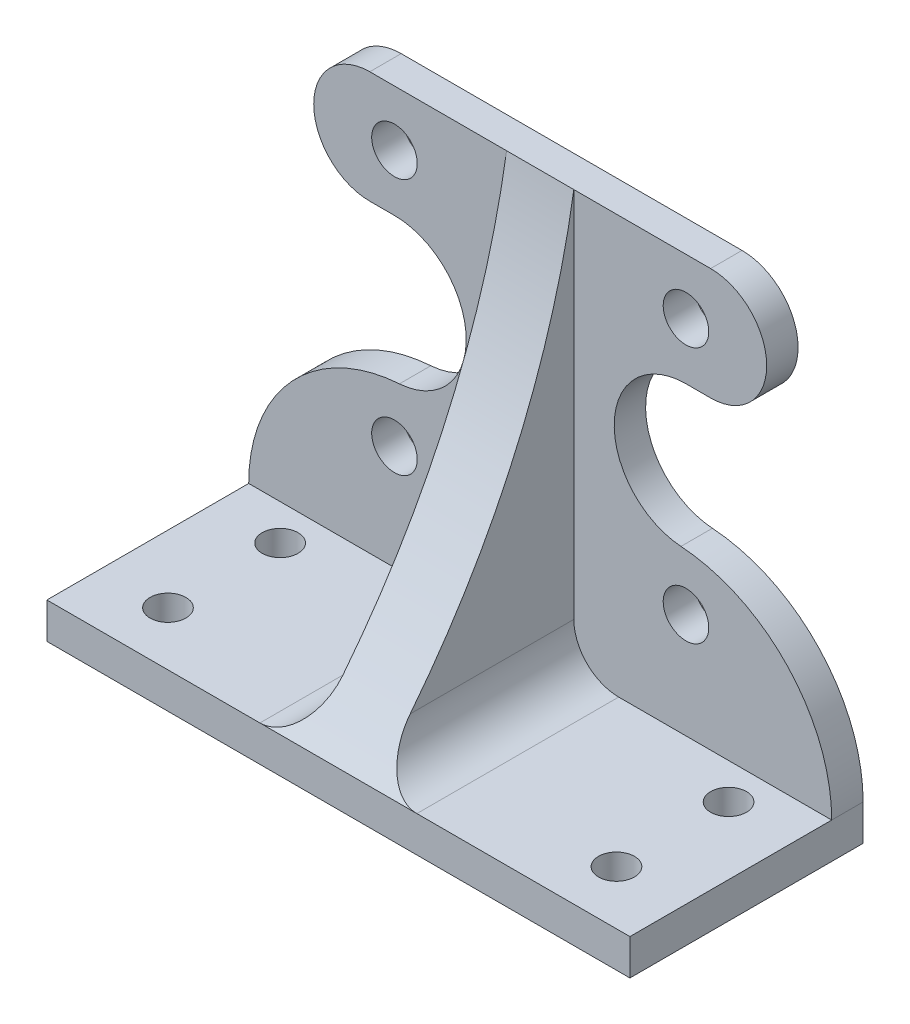
from build123d import *

# Parameters (mm, degrees)
SKETCH1_W               = 130
SKETCH1_H               = 120
BOSS_EXTRUDE1_DEPTH     = 7
SKETCH2_R               = 13.462
SKETCH2_R_2             = 5.08
CUT_EXTRUDE1_DEPTH      = 89.735562206
SKETCH4_W               = 130
SKETCH4_H               = 8
BOSS_EXTRUDE2_DEPTH     = 45
CUT_EXTRUDE4_START      = -10
SKETCH10_R              = 13.462
CUT_EXTRUDE4_DEPTH      = 10
SKETCH11_R              = 4
CUT_EXTRUDE5_DEPTH      = 125.811858411
RIB1_REACH              = 104.611
SKETCH9_WALL_W          = 310.536883344
SKETCH9_WALL_H          = 15
CUT_EXTRUDE6_DEPTH      = 108.518603042
CUT_EXTRUDE6_DEPTH_BACK = 108.518603042
FILLET1_R               = 10


with BuildPart() as part:
    # Sketch1 → Boss-Extrude1 (new body)
    with BuildSketch(Plane.XY):
        Rectangle(SKETCH1_W, SKETCH1_H)
    extrude(amount=BOSS_EXTRUDE1_DEPTH)

    # Sketch2 → Cut-Extrude1 (cut, through all)
    with BuildSketch(Plane.XY.offset(7)):
        with Locations((-32.5, 0)):
            Circle(SKETCH2_R)
        with Locations((-32.5, 28.575)):
            Circle(SKETCH2_R_2)
        with Locations((-32.5, -28.575)):
            Circle(SKETCH2_R_2)
        with Locations(Location((32.5, -28.575, 0), (0, 0, 180))):
            Circle(SKETCH2_R_2)
        with Locations(Location((32.5, 0, 0), (0, 0, 180))):
            Circle(SKETCH2_R)
        with Locations(Location((32.5, 28.575, 0), (0, 0, 180))):
            Circle(SKETCH2_R_2)
    extrude(amount=-CUT_EXTRUDE1_DEPTH, mode=Mode.SUBTRACT)

    # Sketch4 → Boss-Extrude2 (add)
    with BuildSketch(Plane.XY.offset(7)):
        with Locations((0, -56)):
            Rectangle(SKETCH4_W, SKETCH4_H)
    extrude(amount=BOSS_EXTRUDE2_DEPTH)

    # Sketch10 → Cut-Extrude4 (cut)
    with BuildSketch(Plane(origin=(0, 0, 0), x_dir=(-1, 0, 0), z_dir=(0, 0, -1)).offset(CUT_EXTRUDE4_START)):
        with BuildLine():
            ThreePointArc((31.386922126, -15.961236094), (55.292470874, -27.359426204), (65, -52))
            Line((65, -52), (65, 60))
            Line((65, 60), (-65, 60))
            Line((-65, 60), (-65, -52))
            ThreePointArc((-65, -52), (-55.292470874, -27.359426204), (-31.386922126, -15.961236094))
            ThreePointArc((-31.386922126, -15.961236094), (-16.509693913, 0.556876331), (-32.5, 16))
            Line((-32.5, 16), (-38, 16))
            ThreePointArc((-38, 16), (-50.5, 28.5), (-38, 41))
            Line((-38, 41), (38, 41))
            ThreePointArc((38, 41), (50.5, 28.5), (38, 16))
            Line((38, 16), (32.5, 16))
            ThreePointArc((32.5, 16), (16.509693913, 0.556876331), (31.386922126, -15.961236094))
        make_face()
        with Locations((-32.5, 0)):
            Circle(SKETCH10_R, mode=Mode.SUBTRACT)
        with Locations((32.5, 0)):
            Circle(SKETCH10_R, mode=Mode.SUBTRACT)
    extrude(amount=CUT_EXTRUDE4_DEPTH, mode=Mode.SUBTRACT)

    # Sketch11 → Cut-Extrude5 (cut, through all)
    with BuildSketch(Plane(origin=(0, -52, 0), x_dir=(1, 0, 0), z_dir=(0, 1, 0))):
        with Locations(Location((-50, -15, 0), (0, 0, 180))):
            Circle(SKETCH11_R)
        with Locations(Location((-50, -40, 0), (0, 0, 180))):
            Circle(SKETCH11_R)
        with Locations((50, -40)):
            Circle(SKETCH11_R)
        with Locations((50, -15)):
            Circle(SKETCH11_R)
    extrude(amount=-CUT_EXTRUDE5_DEPTH, mode=Mode.SUBTRACT)

    # Sketch9 wall → Rib1 (add, up to next)
    with BuildSketch(Plane(origin=(0, -5.5, 29.5), x_dir=(0, -0.900159251416, 0.435560928104), z_dir=(0, -0.435560928104, -0.900159251416)), mode=Mode.PRIVATE) as rib1_sk1:
        Rectangle(SKETCH9_WALL_W, SKETCH9_WALL_H)
    rib1_tool1 = extrude(rib1_sk1.sketch, amount=RIB1_REACH, mode=Mode.PRIVATE) - part.part
    add(rib1_tool1.solids().sort_by_distance((0, -5.5, 29.5))[0])

    # Sketch13 → Cut-Extrude6 (cut, two sides: drawn at the far end of the back side and taken through both)
    with BuildSketch(Plane(origin=(7.5, 0, 0), x_dir=(0, 0, -1), z_dir=(1, 0, 0)).offset(-CUT_EXTRUDE6_DEPTH_BACK)):
        with BuildLine():
            ThreePointArc((-7, 41), (-22.684215539, -8.797960223), (-52, -52))
            Line((-52, -52), (-7, 41))
        make_face()
    extrude(amount=CUT_EXTRUDE6_DEPTH + CUT_EXTRUDE6_DEPTH_BACK, mode=Mode.SUBTRACT)

    # Fillet1
    # the kernel refuses this fillet: 10 mm, written as the material it adds along each edge
    with BuildSketch(Plane(origin=(7.5, -52, 7), x_dir=(1, 0, 0), z_dir=(0, 0, 1))) as fillet1_piece_1_section:
        with BuildLine():
            CenterArc((FILLET1_R, FILLET1_R), FILLET1_R, 180, 90)
            Line((0, FILLET1_R), (0, 0))
            Line((0, 0), (FILLET1_R, 0))
        make_face()
    fillet1_piece_1 = extrude(amount=45, mode=Mode.PRIVATE)
    fillet1_piece_1 = fillet1_piece_1 - Plane(origin=(9.819534596, 69.603006836, 184.712880794), x_dir=(0, -0.15890559353119482, -0.9872937821866897), z_dir=(-1, 0, 0)) * Cylinder(180, 130, mode=Mode.PRIVATE)
    add(fillet1_piece_1)
    with BuildSketch(Plane(origin=(-7.5, -52, 52), x_dir=(-1, 0, 0), z_dir=(0, 0, -1))) as fillet1_piece_2_section:
        with BuildLine():
            CenterArc((FILLET1_R, FILLET1_R), FILLET1_R, 180, 90)
            Line((0, FILLET1_R), (0, 0))
            Line((0, 0), (FILLET1_R, 0))
        make_face()
    fillet1_piece_2 = extrude(amount=45, mode=Mode.PRIVATE)
    fillet1_piece_2 = fillet1_piece_2 - Plane(origin=(-9.819536327, 69.603006836, 184.712880794), x_dir=(0, -0.15890559353119482, -0.9872937821866897), z_dir=(-1, 0, 0)) * Cylinder(180, 130, mode=Mode.PRIVATE)
    add(fillet1_piece_2)


solid = part.part
